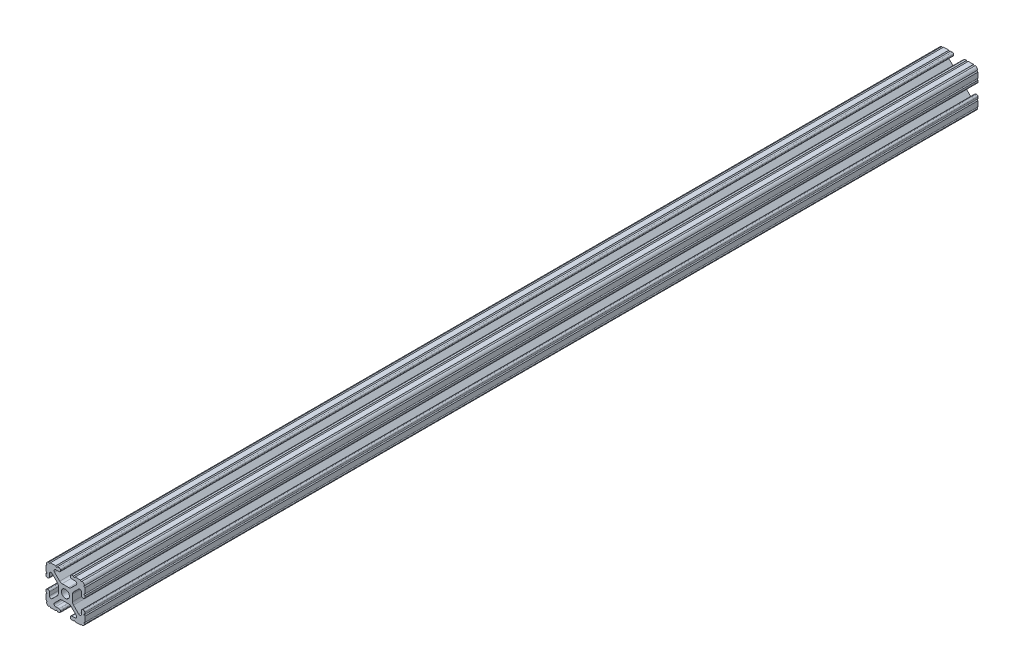
from build123d import *

# Parameters (mm, degrees)
BOSS_EXTRUDE1_DEPTH     = 292
CUT_EXTRUDE1_DEPTH      = 293.55184156
CUT_EXTRUDE1_DEPTH_BACK = 293.55184156
SKETCH5_R               = 0.55245


with BuildPart() as part:
    # Sketch4 → Boss-Extrude1 (new, symmetric)
    with BuildSketch(Plane.XY):
        with BuildLine():
            Line((4.190365, -12.7), (10.11729625, -12.7))
            ThreePointArc((10.11729625, -12.7), (11.943543585, -11.943543585), (12.7, -10.11729625))
            Line((12.7, -10.11729625), (12.7, -4.190365))
            ThreePointArc((12.7, -4.190365), (12.42492494, -3.52627506), (11.760835, -3.2512))
            Line((11.760835, -3.2512), (11.429365, -3.2512))
            ThreePointArc((11.429365, -3.2512), (10.76527506, -3.52627506), (10.4902, -4.190365))
            Line((10.4902, -4.190365), (10.4902, -6.348478019))
            ThreePointArc((10.4902, -6.348478019), (9.830707141, -7.335478831), (8.666460301, -7.103895736))
            Line((8.666460301, -7.103895736), (5.299899128, -3.737334563))
            ThreePointArc((5.299899128, -3.737334563), (4.817571085, -3.015479634), (4.6482, -2.16399369))
            Line((4.6482, -2.16399369), (4.6482, 0))
            Line((4.6482, 0), (2.6035, 0))
            ThreePointArc((2.6035, 0), (1.840952505, -1.840952505), (0, -2.6035))
            Line((0, -2.6035), (0, -4.6482))
            Line((0, -4.6482), (2.16399369, -4.6482))
            ThreePointArc((2.16399369, -4.6482), (3.015479634, -4.817571085), (3.737334563, -5.299899128))
            Line((3.737334563, -5.299899128), (7.103895736, -8.666460301))
            ThreePointArc((7.103895736, -8.666460301), (7.335478831, -9.830707141), (6.348478019, -10.4902))
            Line((6.348478019, -10.4902), (4.190365, -10.4902))
            ThreePointArc((4.190365, -10.4902), (3.52627506, -10.76527506), (3.2512, -11.429365))
            Line((3.2512, -11.429365), (3.2512, -11.760835))
            ThreePointArc((3.2512, -11.760835), (3.52627506, -12.42492494), (4.190365, -12.7))
        make_face()
    extrude(amount=BOSS_EXTRUDE1_DEPTH, both=True)

    # Sketch5 → Cut-Extrude1 (cut, two sides: drawn at the far end of the back side and taken through both)
    with BuildSketch(Plane.XY.offset(-CUT_EXTRUDE1_DEPTH_BACK)):
        with Locations((10.356153152, -12.7)):
            Circle(SKETCH5_R)
        with Locations((5.796028019, -12.7)):
            Circle(SKETCH5_R)
        with Locations((12.7, -10.356153152)):
            Circle(SKETCH5_R)
        with Locations((12.7, -5.796028019)):
            Circle(SKETCH5_R)
    extrude(amount=CUT_EXTRUDE1_DEPTH + CUT_EXTRUDE1_DEPTH_BACK, mode=Mode.SUBTRACT)

    # Mirror1: part across plane


with BuildPart() as part_1:
    add(part.part)
    add(part.part.mirror(Plane(origin=(0, 0, 0), x_dir=(0, 0, 1), z_dir=(1, 0, 0))))

    # Mirror2: part across plane


with BuildPart() as part_2:
    add(part_1.part)
    add(part_1.part.mirror(Plane.ZX))


solid = part_2.part
